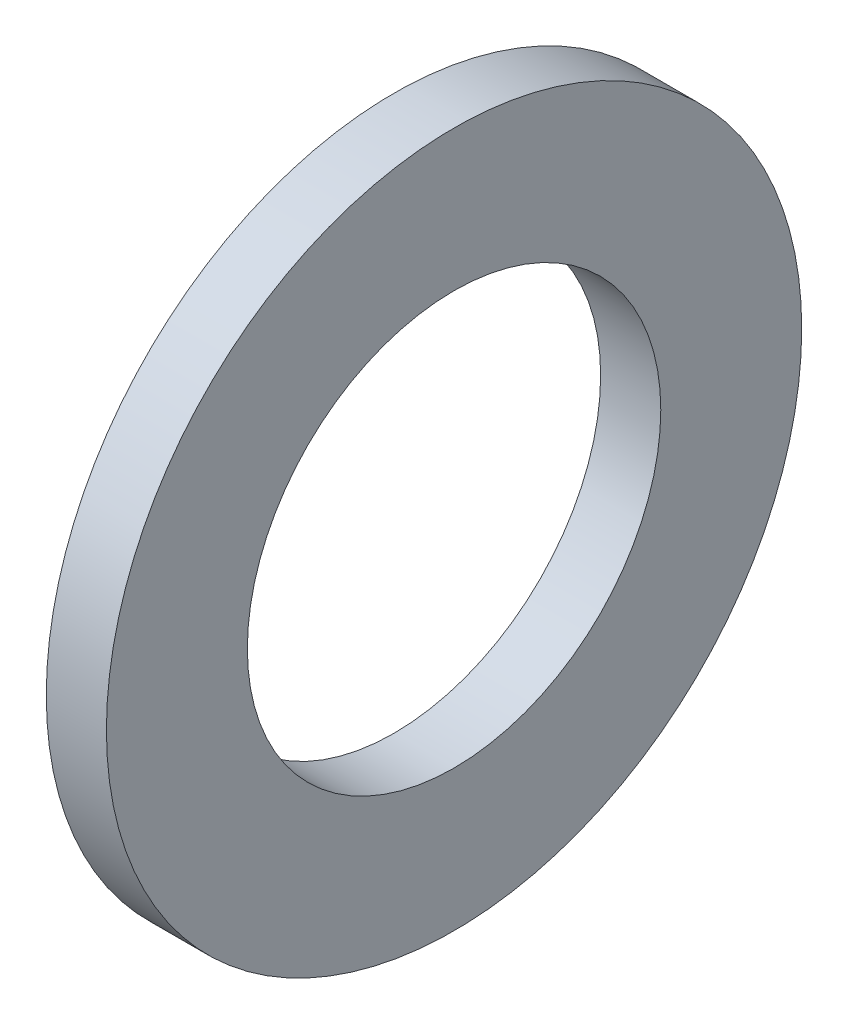
from build123d import *

# Parameters (mm, degrees)
SKETCH1_W = 3.2
SKETCH1_H = 7.5


with BuildPart() as part:
    # Sketch1 → Base-Revolve (revolve)
    with BuildSketch(Plane.XY):
        with Locations((-1.6, 14.75)):
            Rectangle(SKETCH1_W, SKETCH1_H)
    revolve(axis=Axis((-34.925, 0, 0), (1, 0, 0)))


solid = part.part
